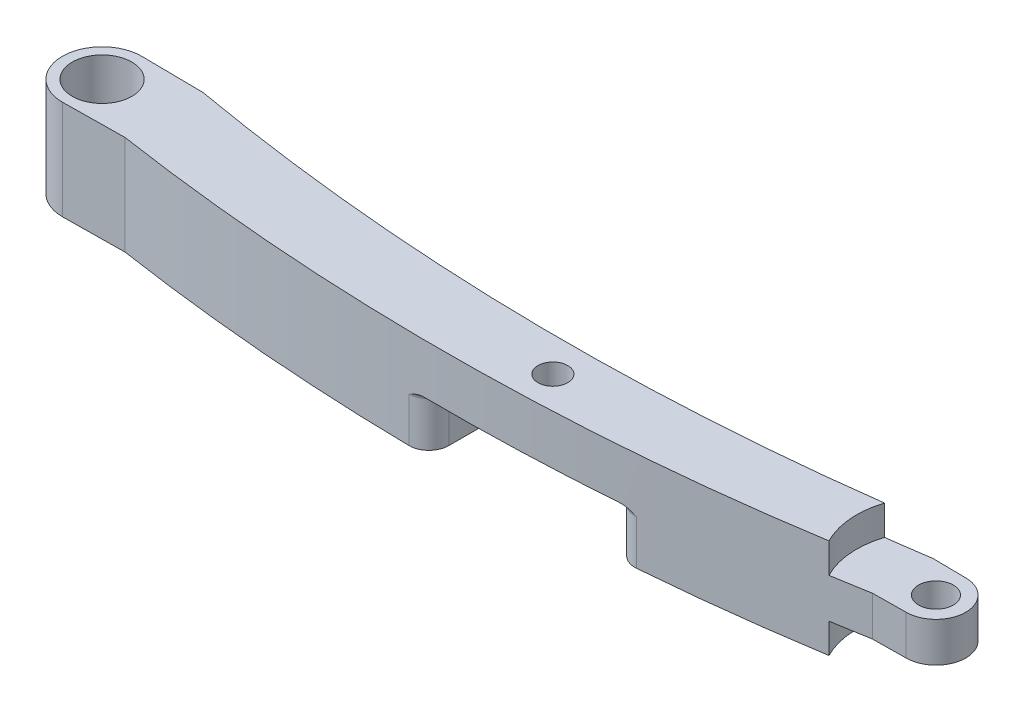
from build123d import *

# Parameters (mm, degrees)
SKETCH1_R               = 3
SKETCH1_R_2             = 1.75
BOSS_EXTRUDE1_DEPTH     = 5
SKETCH3_W               = 8
SKETCH3_H               = 3
SKETCH3_H_2             = 4.010495491
SKETCH4_R               = 1.5
CUT_EXTRUDE1_DEPTH      = 10
CUT_EXTRUDE3_DEPTH      = 72.508687789
CUT_EXTRUDE3_DEPTH_BACK = 72.508687789
SKETCH7_W               = 18
SKETCH7_H               = 5
FILLET2_R               = 2
FILLET3_R               = 0.5


with BuildPart() as part:
    # Sketch1 → Boss-Extrude1 (new, symmetric)
    with BuildSketch(Plane(origin=(0, 0, 0), x_dir=(1, 0, 0), z_dir=(0, 1, 0))):
        with BuildLine():
            Line((-9.729992932, 3.92576688), (-15.965575011, 4))
            ThreePointArc((-15.965575011, 4), (-19.965575011, 0), (-15.965575011, -4))
            Line((-15.965575011, -4), (-9.729992932, -3.92576688))
            ThreePointArc((-9.729992932, -3.92576688), (27.50198709, -6.510792927), (64.661875809, -3.040149395))
            Line((64.661875809, -3.040149395), (68.034424989, -3))
            ThreePointArc((68.034424989, -3), (71.034424989, 0), (68.034424989, 3))
            Line((68.034424989, 3), (64.661875809, 3.040149395))
            ThreePointArc((64.661875809, 3.040149395), (27.429895786, 0.455123348), (-9.729992932, 3.92576688))
        make_face()
        with Locations((-15.965575011, 0)):
            Circle(SKETCH1_R, mode=Mode.SUBTRACT)
        with Locations((68.034424989, 0)):
            Circle(SKETCH1_R_2, mode=Mode.SUBTRACT)
    extrude(amount=BOSS_EXTRUDE1_DEPTH, both=True)

    # Sketch3 → Cut-Revolve1 (revolve, cut)
    with BuildSketch(Plane(origin=(68.034424989, 0, 0), x_dir=(0, 0, -1), z_dir=(1, 0, 0))):
        with Locations((4, -3.5)):
            Rectangle(SKETCH3_W, SKETCH3_H)
        with Locations((4, 4.005247746)):
            Rectangle(SKETCH3_W, SKETCH3_H_2)
    revolve(axis=Axis((68.034424989, 6.010495491, 0), (0, -1, 0)), mode=Mode.SUBTRACT)

    # Sketch4 → Cut-Extrude1 (cut)
    with BuildSketch(Plane(origin=(0, 5, 0), x_dir=(1, 0, 0), z_dir=(0, 1, 0))):
        with Locations((32.466788231, -3.022809684)):
            Circle(SKETCH4_R)
    extrude(amount=-CUT_EXTRUDE1_DEPTH, mode=Mode.SUBTRACT)

    # Sketch7 → Cut-Extrude3 (cut, two sides: drawn at the far end of the back side and taken through both)
    with BuildSketch(Plane.XY.offset(-CUT_EXTRUDE3_DEPTH_BACK)):
        with Locations((32.466788231, -2.5)):
            Rectangle(SKETCH7_W, SKETCH7_H)
    extrude(amount=CUT_EXTRUDE3_DEPTH + CUT_EXTRUDE3_DEPTH_BACK, mode=Mode.SUBTRACT)

    # Fillet2
    fillet2_edges = [part.edges().sort_by_distance(p)[0] for p in [
        (23.466788231, -2.5, -0.536463963),
        (41.466788231, -2.5, -0.716531943),
        (41.466788231, -2.5, 5.919808824),
        (23.466788231, -2.5, 6.523430697),
    ]]
    fillet(fillet2_edges, radius=FILLET2_R)

    # Fillet3
    fillet3_edges = [part.edges().sort_by_distance(p)[0] for p in [
        (23.466788231, 0, 2.950599255),
        (22.870738492, 0, 5.927648567),
        (22.907277279, 0, 0.0105123),
    ]]
    fillet(fillet3_edges, radius=FILLET3_R)
    fillet3_2_edges = [part.edges().sort_by_distance(p)[0] for p in [
        (42.111819151, 0, 5.229782959),
        (41.466788231, 0, 2.469198888),
        (42.012605823, 0, -0.193392918),
    ]]
    fillet(fillet3_2_edges, radius=FILLET3_R)


solid = part.part
